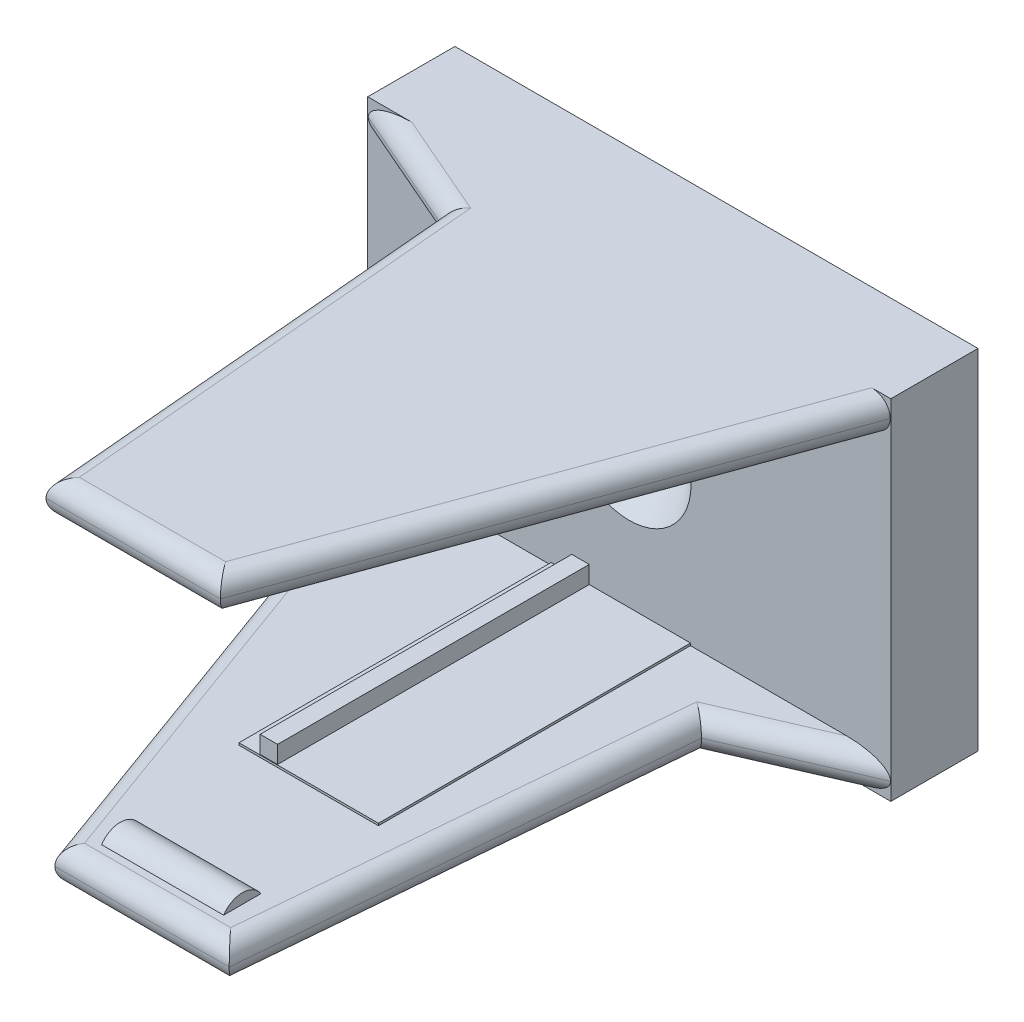
from build123d import *

# Parameters (mm, degrees)
ESQUISSE1_W                                       = 10
ESQUISSE1_H                                       = 20
ESQUISSE1_W_2                                     = 20
BOSS_EXTRU_3_DEPTH                                = 5
BOSS_EXTRU_5_DEPTH                                = 2
ESQUISSE15_W                                      = 8
ESQUISSE15_H                                      = 17.913431031
BOSS_EXTRU_6_DEPTH                                = 0.1
ESQUISSE16_W                                      = 1
ESQUISSE16_H                                      = 17.913431031
BOSS_EXTRU_7_DEPTH                                = 1
BOSS_EXTRU_11_DEPTH                               = 2
ESQUISSE32_W                                      = 8
ESQUISSE32_H                                      = 17.913431031
BOSS_EXTRU_14_DEPTH                               = 0.125
ESQUISSE42_R                                      = 1.279103286
BOSS_EXTRU_18_DEPTH                               = 7
ESQUISSE56_R                                      = 1.3
BOSS_EXTRU_20_DEPTH                               = 7
CONG_4_R                                          = 1
ESQUISSE33_W                                      = 1
ESQUISSE33_H                                      = 17.913431031
BOSS_EXTRU_15_DEPTH                               = 1
ESQUISSE35_R                                      = 2.128247198
ENL_V_MAT_EXTRU_1_DEPTH                           = 5
ESQUISSE37_W                                      = 26
ESQUISSE37_H                                      = 16
ENL_V_MAT_EXTRU_2_DEPTH                           = 3
ESQUISSE38_R                                      = 3.5
BOSS_EXTRU_17_DEPTH                               = 3
ESQUISSE35_3_R                                    = 2.128247198
ENL_V_MAT_EXTRU_3_DEPTH                           = 5
FRAISAGE_POUR_VIS_T_TE_FRAIS_E_BOMB_E_D           = 3.7973
FRAISAGE_POUR_VIS_T_TE_FRAIS_E_BOMB_E_CSINK_D     = 7.0866
FRAISAGE_POUR_VIS_T_TE_FRAIS_E_BOMB_E_CSINK_ANGLE = 82


with BuildPart() as part:
    # Esquisse1 → Boss.-Extru.3 (new body)
    with BuildSketch(Plane.XY):
        with Locations((25, 10)):
            Rectangle(ESQUISSE1_W, ESQUISSE1_H)
        with Locations((10, 10)):
            Rectangle(ESQUISSE1_W_2, ESQUISSE1_H)
    extrude(amount=BOSS_EXTRU_3_DEPTH)

    # Esquisse14 → Boss.-Extru.5 (add)
    with BuildSketch(Plane(origin=(0, 20, 0), x_dir=(1, 0, 0), z_dir=(0, 1, 0))):
        Polygon((29.977520524, -4.978412673), (19.716916224, -33.169191296), (9.716916224, -33.169191296), (7.538022655, -8.264323844), (-0.022479476, -4.978412673), align=None)
    extrude(amount=-BOSS_EXTRU_5_DEPTH)

    # Esquisse15 → Boss.-Extru.6 (add)
    with BuildSketch(Plane(origin=(0, 18, 0), x_dir=(-1, 0, 0), z_dir=(0, -1, 0))):
        with Locations((-14.823599663, -13.956715516)):
            Rectangle(ESQUISSE15_W, ESQUISSE15_H)
    extrude(amount=BOSS_EXTRU_6_DEPTH)

    # Esquisse16 → Boss.-Extru.7 (add)
    with BuildSketch(Plane.XZ.offset(-17.9)):
        with Locations((12.323594191, 13.956715516)):
            Rectangle(ESQUISSE16_W, ESQUISSE16_H)
    extrude(amount=BOSS_EXTRU_7_DEPTH)



with BuildPart() as body_2:
    # Esquisse20 → Boss.-Extru.11 (new body)
    with BuildSketch(Plane(origin=(0, 0, 0), x_dir=(-1, 0, 0), z_dir=(0, -1, 0))):
        Polygon((0.007816785, -5.006477186), (-10.252787515, -33.19725581), (-20.252787515, -33.19725581), (-22.431681083, -8.292388358), (-29.992183215, -5.006477186), align=None)
    extrude(amount=-BOSS_EXTRU_11_DEPTH)


with BuildPart() as part_1:
    add(part.part)

    add(body_2.part)  # Boss.-Extru.14 merges body 2
    # Esquisse32 → Boss.-Extru.14 (add)
    with BuildSketch(Plane(origin=(0, 2, 0), x_dir=(1, 0, 0), z_dir=(0, 1, 0))):
        with Locations((14.516805055, -13.946251691)):
            Rectangle(ESQUISSE32_W, ESQUISSE32_H)
    extrude(amount=BOSS_EXTRU_14_DEPTH)

    # Esquisse42 → Boss.-Extru.18 (add)
    with BuildSketch(Plane(origin=(18.516805055, 0, 0), x_dir=(0, 0, -1), z_dir=(1, 0, 0))):
        with Locations((-30.710413968, 1.3)):
            Circle(ESQUISSE42_R)
    extrude(amount=-BOSS_EXTRU_18_DEPTH)

    # Esquisse56 → Boss.-Extru.20 (add)
    with BuildSketch(Plane(origin=(18.823599663, 0, 0), x_dir=(0, 0, -1), z_dir=(1, 0, 0))):
        with Locations((-30.475906609, 18.642606084)):
            Circle(ESQUISSE56_R)
    extrude(amount=-BOSS_EXTRU_20_DEPTH)

    # Congé4
    cong_4_edges = [part_1.edges().sort_by_distance(p)[0] for p in [
        (5.122485365, 2, 19.101866498),
        (5.122485365, 0, 19.101866498),
        (15.252787515, 0, 33.19725581),
        (15.252787515, 2, 33.19725581),
        (21.342234299, 2, 20.744822084),
        (21.342234299, 0, 20.744822084),
        (26.211932149, 2, 6.649432772),
        (26.211932149, 0, 6.649432772),
        (3.782606563, 18, 6.632161922),
        (3.782606563, 20, 6.632161922),
        (8.62746944, 18, 20.71675757),
        (8.62746944, 20, 20.71675757),
        (14.716916224, 18, 33.169191296),
        (14.716916224, 20, 33.169191296),
        (24.843289802, 18, 19.084595648),
        (24.843289802, 20, 19.084595648),
    ]]
    fillet(cong_4_edges, radius=CONG_4_R - 0.0001)  # a hair under: the kernel refuses the full size

    # Esquisse33 → Boss.-Extru.15 (add)
    with BuildSketch(Plane(origin=(0, 2.125, 0), x_dir=(-1, 0, 0), z_dir=(0, 1, 0))):
        with Locations((-12.203810405, 13.919189864)):
            Rectangle(ESQUISSE33_W, ESQUISSE33_H)
    extrude(amount=BOSS_EXTRU_15_DEPTH)

    # Esquisse35 → Enlèv. mat.-Extru.1 (cut)
    with BuildSketch(Plane.XY.offset(5)):
        with Locations((15, 10)):
            Circle(ESQUISSE35_R)
    extrude(amount=-ENL_V_MAT_EXTRU_1_DEPTH, mode=Mode.SUBTRACT)

    # Esquisse37 → Enlèv. mat.-Extru.2 (cut)
    with BuildSketch(Plane(origin=(0, 0, 0), x_dir=(-1, 0, 0), z_dir=(0, 0, -1))):
        with Locations((-15, 10)):
            Rectangle(ESQUISSE37_W, ESQUISSE37_H)
    extrude(amount=-ENL_V_MAT_EXTRU_2_DEPTH, mode=Mode.SUBTRACT)

    # Esquisse38 → Boss.-Extru.17 (add)
    with BuildSketch(Plane(origin=(0, 0, 3), x_dir=(-1, 0, 0), z_dir=(0, 0, -1))):
        with Locations(Location((-15, 10, 0), (0, 0, 180))):
            Circle(ESQUISSE38_R)
    extrude(amount=BOSS_EXTRU_17_DEPTH)

    # Esquisse35<3> → Enlèv. mat.-Extru.3 (cut)
    with BuildSketch(Plane.XY.offset(5)):
        with Locations((15, 10)):
            Circle(ESQUISSE35_3_R)
    extrude(amount=-ENL_V_MAT_EXTRU_3_DEPTH, mode=Mode.SUBTRACT)

    # Fraisage pour vis à tête fraisée bombée #61 (through all)
    with Locations(Plane.XY.offset(5)):
        with Locations((15, 10)):
            CounterSinkHole(FRAISAGE_POUR_VIS_T_TE_FRAIS_E_BOMB_E_D / 2, FRAISAGE_POUR_VIS_T_TE_FRAIS_E_BOMB_E_CSINK_D / 2, counter_sink_angle=FRAISAGE_POUR_VIS_T_TE_FRAIS_E_BOMB_E_CSINK_ANGLE)


solid = part_1.part
